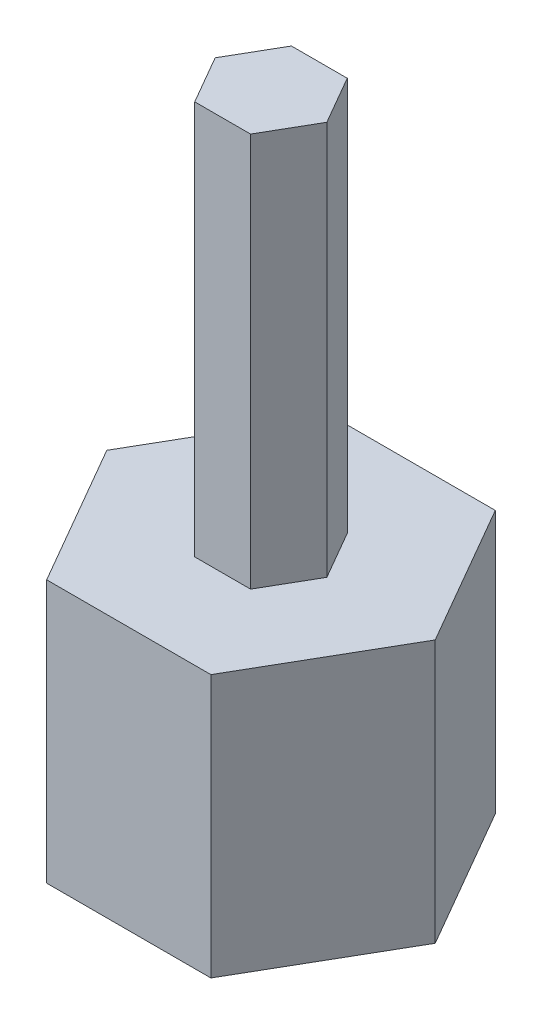
from build123d import *

# Parameters (mm, degrees)
BOSS_EXTRUDE1_DEPTH = 6
BOSS_EXTRUDE2_DEPTH = 4


with BuildPart() as part:
    # Sketch1 → Boss-Extrude1 (new body)
    with BuildSketch(Plane(origin=(0, 0, 0), x_dir=(1, 0, 0), z_dir=(0, 1, 0))):
        Polygon((0.85, 0), (0.425, 0.736121593), (-0.425, 0.736121593), (-0.85, 0), (-0.425, -0.736121593), (0.425, -0.736121593), align=None)
    extrude(amount=BOSS_EXTRUDE1_DEPTH)

    # Sketch2 → Boss-Extrude2 (add)
    with BuildSketch(Plane.XZ):
        Polygon((2.5, 0), (1.25, 2.165063509), (-1.25, 2.165063509), (-2.5, 0), (-1.25, -2.165063509), (1.25, -2.165063509), align=None)
    extrude(amount=BOSS_EXTRUDE2_DEPTH)


solid = part.part
